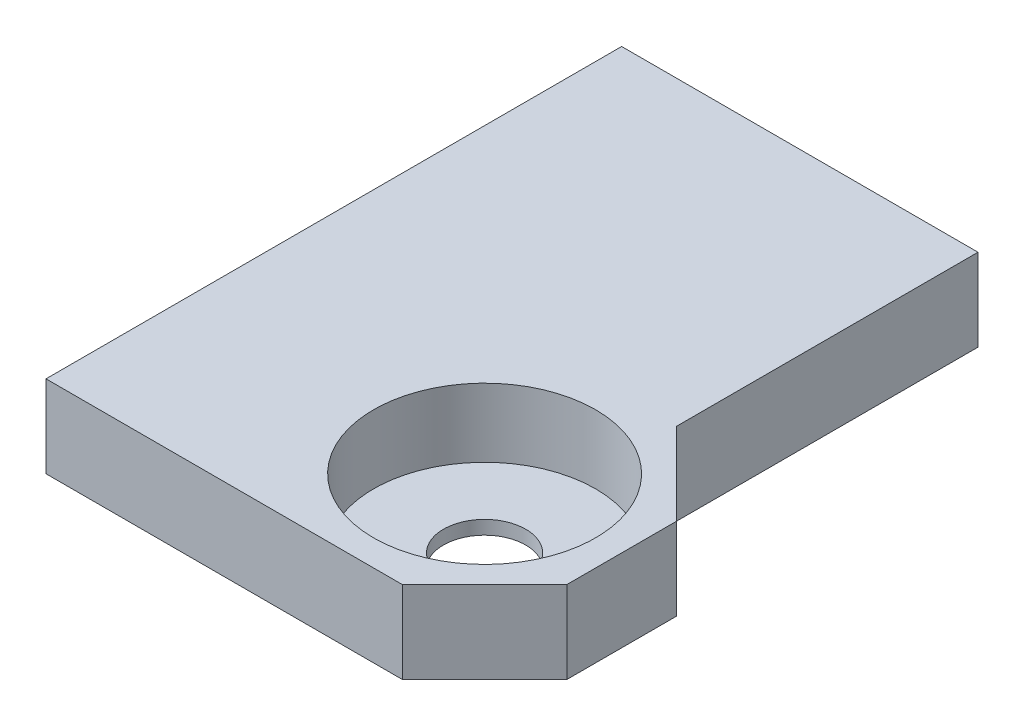
from build123d import *

# Parameters (mm, degrees)
SKETCH1_R           = 3
BOSS_EXTRUDE1_DEPTH = 6
CHAMFER1_SIZE       = 6
SKETCH2_R           = 8.1
CUT_EXTRUDE1_DEPTH  = 5


with BuildPart() as part:
    # Sketch1 → Boss-Extrude1 (new body)
    with BuildSketch(Plane(origin=(0, 0, 0), x_dir=(1, 0, 0), z_dir=(0, 1, 0))):
        Polygon((0, 0), (32, 0), (32, 20), (26, 20), (26, 42), (0, 42), align=None)
        with Locations(Location((22, 10, 0), (0, 0, 270))):
            Circle(SKETCH1_R, mode=Mode.SUBTRACT)
    extrude(amount=BOSS_EXTRUDE1_DEPTH)

    # Chamfer1
    chamfer1_edges = [part.edges().sort_by_distance(p)[0] for p in [
        (32, 3, -20),
        (32, 3, 0),
    ]]
    chamfer(chamfer1_edges, length=CHAMFER1_SIZE - 0.0001)  # a hair under: the kernel refuses the full size

    # Sketch2 → Cut-Extrude1 (cut)
    with BuildSketch(Plane(origin=(0, 6, 0), x_dir=(1, 0, 0), z_dir=(0, 1, 0))):
        with Locations(Location((22, 10, 0), (0, 0, 270))):
            Circle(SKETCH2_R)
    extrude(amount=-CUT_EXTRUDE1_DEPTH, mode=Mode.SUBTRACT)


solid = part.part
